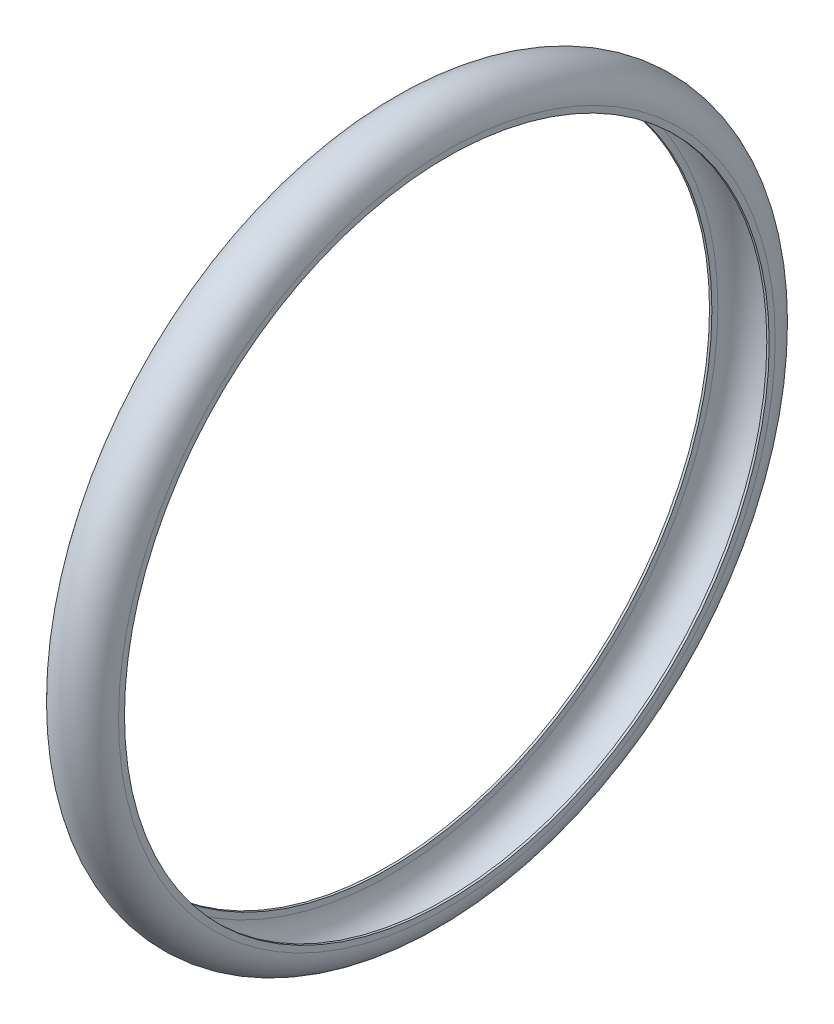
from build123d import *

# Parameters (mm, degrees)
SKETCH1_R           = 300
SKETCH1_R_2         = 270
BOSS_EXTRUDE1_DEPTH = 50
FILLET1_R           = 25
SHELL1_T            = -2


with BuildPart() as part:
    # Sketch1 → Boss-Extrude1 (new body)
    with BuildSketch(Plane(origin=(0, 0, 0), x_dir=(0, 0, -1), z_dir=(1, 0, 0))):
        Circle(SKETCH1_R)
        Circle(SKETCH1_R_2, mode=Mode.SUBTRACT)
    extrude(amount=BOSS_EXTRUDE1_DEPTH)

    # Fillet1
    fillet1_edges = [part.edges().sort_by_distance(p)[0] for p in [
        (0, 0, 300),
        (50, 0, 300),
    ]]
    fillet(fillet1_edges, radius=FILLET1_R - 0.0001)  # a hair under: the kernel refuses the full size

    # Shell1
    shell1_openings = [part.faces().sort_by_distance(p)[0] for p in [
        (25, 0, 270),
    ]]
    offset(amount=SHELL1_T, openings=shell1_openings, kind=Kind.INTERSECTION)


solid = part.part
